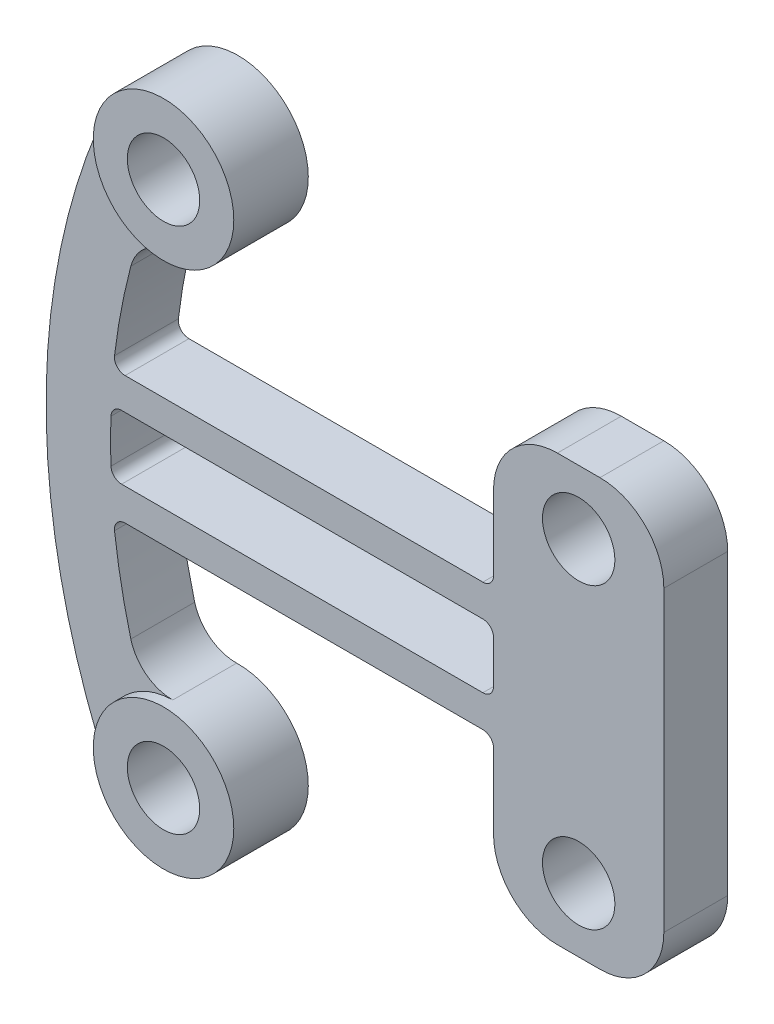
from build123d import *

# Parameters (mm, degrees)
BOSS_EXTRUDE1_DEPTH  = 3
SKETCH2_W            = 8
SKETCH2_H            = 3
BOSS_EXTRUDE2_DEPTH  = 7
SKETCH3_W            = 8
SKETCH3_H            = 3
BOSS_EXTRUDE3_DEPTH  = 7
SKETCH4_R            = 3.300094696
BOSS_EXTRUDE4_DEPTH  = 0.5
SKETCH5_R            = 3.300094696
BOSS_EXTRUDE5_DEPTH  = 0.5
CUT_EXTRUDE1_DEPTH   = 23.598862664
M3_CLEARANCE_HOLE2_D = 3.4
M3_CLEARANCE_HOLE1_D = 3.4
FILLET1_R            = 0.5
FILLET2_R            = 2
FILLET3_R            = 3


with BuildPart() as part:
    # Sketch1 → Boss-Extrude1 (new body)
    with BuildSketch(Plane(origin=(0, 0, 0), x_dir=(-1, 0, 0), z_dir=(0, 0, -1))):
        with BuildLine():
            Line((-16, 3), (-16, -3))
            Line((-16, -3), (9.864129683, -3))
            ThreePointArc((9.864129683, -3), (9.35323266, -6.252551424), (8.487341847, -9.429080919))
            ThreePointArc((8.487341847, -9.429080919), (3.884055388, -13.461974782), (9.996965881, -13.756600705))
            ThreePointArc((9.996965881, -13.756600705), (13.015220034, 0), (9.996965881, 13.756600705))
            ThreePointArc((9.996965881, 13.756600705), (3.884055388, 13.461974781), (8.487341847, 9.429080919))
            ThreePointArc((8.487341847, 9.429080919), (9.35323266, 6.252551424), (9.864129683, 3))
            Line((9.864129683, 3), (-16, 3))
        make_face()
    extrude(amount=-BOSS_EXTRUDE1_DEPTH)

    # Sketch2 → Boss-Extrude2 (add)
    with BuildSketch(Plane.XZ.offset(3)):
        with Locations((12, 1.5)):
            Rectangle(SKETCH2_W, SKETCH2_H)
    extrude(amount=BOSS_EXTRUDE2_DEPTH)

    # Sketch3 → Boss-Extrude3 (add)
    with BuildSketch(Plane(origin=(0, 3, 0), x_dir=(-1, 0, 0), z_dir=(0, 1, 0))):
        with Locations((-12, 1.5)):
            Rectangle(SKETCH3_W, SKETCH3_H)
    extrude(amount=BOSS_EXTRUDE3_DEPTH)

    # Sketch4 → Boss-Extrude4 (add)
    with BuildSketch(Plane.XY.offset(3)):
        with Locations((-7, 12.375)):
            Circle(SKETCH4_R)
    extrude(amount=BOSS_EXTRUDE4_DEPTH)

    # Sketch5 → Boss-Extrude5 (add)
    with BuildSketch(Plane.XY.offset(3)):
        with Locations((-7, -12.375)):
            Circle(SKETCH5_R)
    extrude(amount=BOSS_EXTRUDE5_DEPTH)

    # Sketch6 → Cut-Extrude1 (cut, through all)
    with BuildSketch(Plane.XY.offset(3)):
        with BuildLine():
            Line((8, 1.5), (-9.948163366, 1.5))
            ThreePointArc((-9.948163366, 1.5), (-9.985864188, 0), (-9.948163366, -1.5))
            Line((-9.948163366, -1.5), (8, -1.5))
            Line((8, -1.5), (8, 1.5))
        make_face()
    extrude(amount=-CUT_EXTRUDE1_DEPTH, mode=Mode.SUBTRACT)

    # M3 Clearance Hole2 (through all)
    with Locations(Plane(origin=(0, 0, 0), x_dir=(-1, 0, 0), z_dir=(0, 0, -1))):
        with Locations((-12, -7), (-12, 7)):
            Hole(M3_CLEARANCE_HOLE2_D / 2)

    # M3 Clearance Hole1 (through all)
    with Locations(Plane(origin=(0, 0, 0), x_dir=(-1, 0, 0), z_dir=(0, 0, -1))):
        with Locations((7, 12.375), (7, -12.375)):
            Hole(M3_CLEARANCE_HOLE1_D / 2)

    # Fillet1
    fillet1_edges = [part.edges().sort_by_distance(p)[0] for p in [
        (8, 3, 1.5),
        (8, -3, 1.5),
        (-9.864129683, 3, 1.5),
        (-9.948163366, -1.5, 1.5),
        (8, 1.5, 1.5),
        (-9.948163366, 1.5, 1.5),
        (-9.864129683, -3, 1.5),
        (8, -1.5, 1.5),
    ]]
    fillet(fillet1_edges, radius=FILLET1_R)

    # Fillet2
    fillet2_edges = [part.edges().sort_by_distance(p)[0] for p in [
        (-8.487341847, -9.429080919, 1.5),
        (-8.487341847, 9.429080919, 1.5),
    ]]
    fillet(fillet2_edges, radius=FILLET2_R)

    # Fillet3
    fillet3_edges = [part.edges().sort_by_distance(p)[0] for p in [
        (16, -10, 1.5),
        (8, -10, 1.5),
        (16, 10, 1.5),
        (8, 10, 1.5),
    ]]
    fillet(fillet3_edges, radius=FILLET3_R)


solid = part.part
